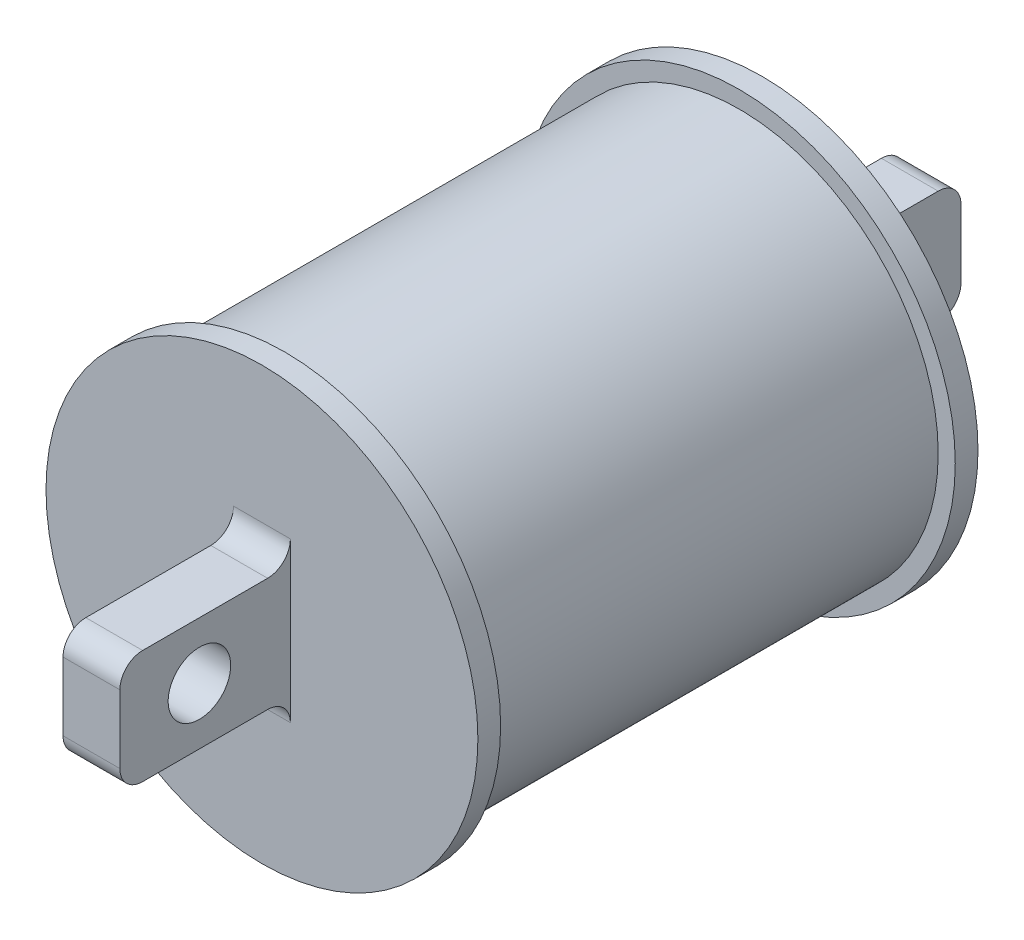
from build123d import *

# Parameters (mm, degrees)
SKETCH1_R            = 22.225
BOSS_EXTRUDE1_DEPTH  = 25.4
SKETCH2_R            = 24.13
BOSS_EXTRUDE2_DEPTH  = 2.54
SKETCH3_W            = 6.35
SKETCH3_H            = 12.7
BOSS_EXTRUDE3_DEPTH  = 19.05
SKETCH4_R            = 3.4925
CUT_EXTRUDE1_DEPTH   = 60.463266182
FILLET1_R            = 2.54
FILLET1_OF_MIRROR1_R = 2.54


with BuildPart() as part:
    # Sketch1 → Boss-Extrude1 (new, symmetric)
    with BuildSketch(Plane.XY):
        Circle(SKETCH1_R)
    extrude(amount=BOSS_EXTRUDE1_DEPTH, both=True)

    # Sketch2 → Boss-Extrude2 (add)
    with BuildSketch(Plane.XY.offset(25.4)):
        Circle(SKETCH2_R)
    boss_extrude2 = extrude(amount=BOSS_EXTRUDE2_DEPTH)

    # Sketch3 → Boss-Extrude3 (add)
    with BuildSketch(Plane.XY.offset(27.94)):
        Rectangle(SKETCH3_W, SKETCH3_H)
    boss_extrude3 = extrude(amount=BOSS_EXTRUDE3_DEPTH)

    # Sketch4 → Cut-Extrude1 (cut, through all)
    with BuildSketch(Plane(origin=(3.175, 0, 0), x_dir=(0, 0, -1), z_dir=(1, 0, 0))):
        with Locations((-38.1, 0)):
            Circle(SKETCH4_R)
    cut_extrude1 = extrude(amount=-CUT_EXTRUDE1_DEPTH, mode=Mode.SUBTRACT)

    # Fillet1
    fillet1_edges = [part.edges().sort_by_distance(p)[0] for p in [
        (0, -6.35, 27.94),
        (0, 6.35, 27.94),
        (0, -6.35, 46.99),
        (0, 6.35, 46.99),
    ]]
    fillet(fillet1_edges, radius=FILLET1_R)

    # Mirror1: Boss-Extrude2, Boss-Extrude3, Cut-Extrude1 across plane
    add(boss_extrude2.mirror(Plane.XY))
    add(boss_extrude3.mirror(Plane.XY))
    add(cut_extrude1.mirror(Plane.XY), mode=Mode.SUBTRACT)

    # Fillet1 of Mirror1
    fillet1_of_mirror1_edges = [part.edges().sort_by_distance(p)[0] for p in [
        (0, -6.35, -27.94),
        (0, 6.35, -27.94),
        (0, -6.35, -46.99),
        (0, 6.35, -46.99),
    ]]
    fillet(fillet1_of_mirror1_edges, radius=FILLET1_OF_MIRROR1_R)


solid = part.part
